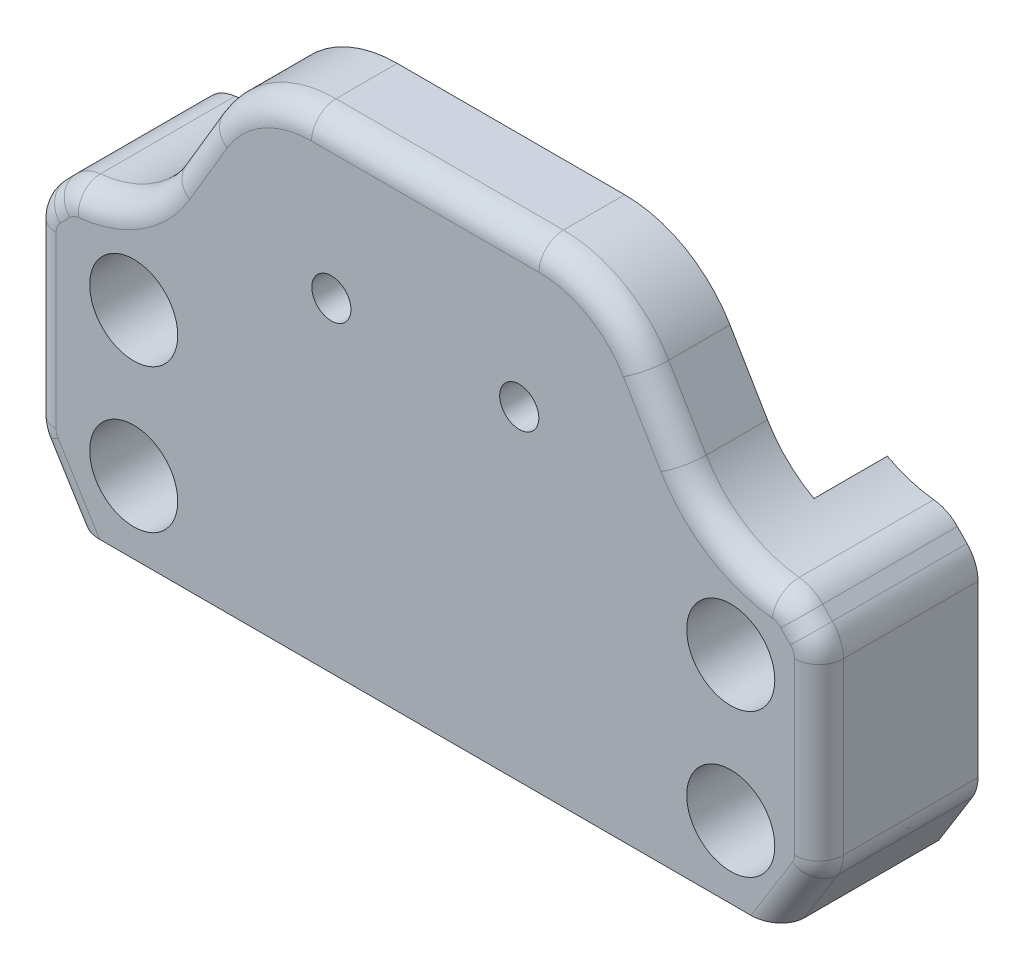
from build123d import *

# Parameters (mm, degrees)
BOSS_EXTRUDE1_DEPTH = 13
SHELL1_T            = -3
BOSS_EXTRUDE4_REACH = 64.152
SKETCH3_W           = 49.533157258
SKETCH3_H           = 6
CUT_EXTRUDE1_DEPTH  = 15
SKETCH4_R           = 1.6
CUT_EXTRUDE2_DEPTH  = 63.15219427
SKETCH7_R           = 2.1
SKETCH7_R_2         = 2.123676058
CUT_EXTRUDE3_DEPTH  = 63.15219427
FILLET2_R           = 10
SKETCH9_R           = 3.6
CUT_EXTRUDE4_DEPTH  = 10
FILLET3_R           = 2
FILLET4_R           = 2


with BuildPart() as part:
    # Sketch1 → Boss-Extrude1 (new body)
    with BuildSketch(Plane.XY):
        with BuildLine():
            Line((-28.97340569, 12.706331578), (28.973405725, 12.706331578))
            ThreePointArc((28.973405725, 12.706331578), (30.340636754, 14.906212876), (31.707400411, 17.106384579))
            add(Edge.make_bspline(
                [(31.707400411, 17.106384579), (31.860577483, 17.353017467), (31.977075411, 17.615910694), (32.136499753, 18.174255748), (32.176374769, 18.459007227), (32.176374769, 18.749342959)],
                knots=[0, 0, 0, 0, 0.5, 0.5, 1, 1, 1, 1], degree=3))
            Line((32.176374769, 18.749342959), (32.176374769, 32.652469049))
            add(Edge.make_bspline(
                [(32.176374769, 32.652469049), (32.176374769, 33.063943899), (32.098154583, 33.461022406), (31.865768669, 34.032167566), (31.771208107, 34.212098764), (31.549330643, 34.551940749), (31.421075594, 34.712743302), (31.277822081, 34.860353405)],
                knots=[0, 0, 0, 0, 0.5, 0.5, 0.75, 0.75, 1, 1, 1, 1], degree=3))
            Line((31.277822081, 34.860353405), (30.487300189, 35.674916452))
            ThreePointArc((30.487300189, 35.674916452), (29.607044875, 36.310979796), (28.562260308, 36.60737683))
            ThreePointArc((28.562260308, 36.60737683), (24.188286012, 38.132581102), (20.970896962, 41.465193727))
            Line((20.970896962, 41.465193727), (17.903524097, 46.651813915))
            ThreePointArc((17.903524097, 46.651813915), (14.250692031, 50.247702437), (9.296114179, 51.561382255))
            Line((9.296114179, 51.561382255), (-9.296114179, 51.561382255))
            ThreePointArc((-9.296114179, 51.561382255), (-14.250692031, 50.247702437), (-17.903524097, 46.651813915))
            Line((-17.903524097, 46.651813915), (-20.970896965, 41.465193723))
            ThreePointArc((-20.970896965, 41.465193723), (-24.188286003, 38.132581106), (-28.562260281, 36.607376829))
            ThreePointArc((-28.562260281, 36.607376829), (-29.607044844, 36.310979794), (-30.487300153, 35.674916452))
            Line((-30.487300153, 35.674916452), (-31.277822046, 34.860353405))
            add(Edge.make_bspline(
                [(-31.277822046, 34.860353405), (-31.56434582, 34.565115941), (-31.786145355, 34.226361182), (-32.019314667, 33.655528877), (-32.077486277, 33.460815095), (-32.156036537, 33.062812087), (-32.176374734, 32.858215252), (-32.176374734, 32.652469049)],
                knots=[0, 0, 0, 0, 0.5, 0.5, 0.75, 0.75, 1, 1, 1, 1], degree=3))
            Line((-32.176374734, 32.652469049), (-32.176374734, 18.749342959))
            add(Edge.make_bspline(
                [(-32.176374734, 18.749342959), (-32.176374734, 18.459007232), (-32.136497798, 18.174245088), (-31.977070924, 17.615899046), (-31.860577442, 17.353017458), (-31.707400375, 17.106384579)],
                knots=[0, 0, 0, 0, 0.5, 0.5, 1, 1, 1, 1], degree=3))
            ThreePointArc((-31.707400375, 17.106384579), (-30.340636718, 14.906212876), (-28.97340569, 12.706331578))
        make_face()
    extrude(amount=BOSS_EXTRUDE1_DEPTH)

    # Shell1
    shell1_openings = [part.faces().sort_by_distance(p)[0] for p in [
        (1.46e-07, 29.861622889, 0),
    ]]
    offset(amount=SHELL1_T, openings=shell1_openings, kind=Kind.INTERSECTION)

    # Boss-Extrude4: up to this face of the body (flat: up to its plane)
    boss_extrude4_end = Plane(part.part.faces().sort_by_distance((3.6e-08, 30.015982435, 10))[0])
    # Sketch6 → Boss-Extrude4 (add, up to the picked face)
    with BuildSketch(Plane(origin=(0, 0, 0), x_dir=(-1, 0, 0), z_dir=(0, 0, -1)), mode=Mode.PRIVATE) as boss_extrude4_sk1:
        with BuildLine():
            Line((-18.532419847, 45.588414212), (-18.532419847, 12.706331578))
            Line((-18.532419847, 12.706331578), (-28.973405725, 12.706331578))
            ThreePointArc((-28.973405725, 12.706331578), (-30.340636754, 14.906212876), (-31.707400411, 17.106384579))
            add(Edge.make_bspline(
                [(-32.176374769, 18.749342959), (-32.176374769, 18.459007227), (-32.136499753, 18.174255748), (-31.977075411, 17.615910694), (-31.860577483, 17.353017467), (-31.707400411, 17.106384579)],
                knots=[0, 0, 0, 0, 0.5, 0.5, 1, 1, 1, 1], degree=3))
            Line((-32.176374769, 18.749342959), (-32.176374769, 32.652469049))
            add(Edge.make_bspline(
                [(-31.277822081, 34.860353405), (-31.421075594, 34.712743302), (-31.549330643, 34.551940749), (-31.771208107, 34.212098764), (-31.865768669, 34.032167566), (-32.098154583, 33.461022406), (-32.176374769, 33.063943899), (-32.176374769, 32.652469049)],
                knots=[0, 0, 0, 0, 0.25, 0.25, 0.5, 0.5, 1, 1, 1, 1], degree=3))
            Line((-31.277822081, 34.860353405), (-30.487300189, 35.674916452))
            ThreePointArc((-30.487300189, 35.674916452), (-29.607044875, 36.310979796), (-28.562260308, 36.60737683))
            ThreePointArc((-28.562260308, 36.60737683), (-24.188286012, 38.132581102), (-20.970896962, 41.465193727))
            Line((-20.970896962, 41.465193727), (-18.532419847, 45.588414212))
        make_face()
    boss_extrude4_tool1 = split(extrude(boss_extrude4_sk1.sketch, amount=-BOSS_EXTRUDE4_REACH, mode=Mode.PRIVATE), bisect_by=boss_extrude4_end, keep=Keep.BOTH, mode=Mode.PRIVATE)
    # Sketch6 → Boss-Extrude4 (add, up to the picked face)
    with BuildSketch(Plane(origin=(0, 0, 0), x_dir=(-1, 0, 0), z_dir=(0, 0, -1)), mode=Mode.PRIVATE) as boss_extrude4_sk2:
        with BuildLine():
            Line((28.97340569, 12.706331578), (18.53241985, 12.706331578))
            Line((18.53241985, 12.706331578), (18.53241985, 45.588414209))
            Line((18.53241985, 45.588414209), (20.970896965, 41.465193723))
            ThreePointArc((20.970896965, 41.465193723), (24.188286003, 38.132581106), (28.562260281, 36.607376829))
            ThreePointArc((28.562260281, 36.607376829), (29.607044844, 36.310979794), (30.487300153, 35.674916452))
            Line((30.487300153, 35.674916452), (31.277822046, 34.860353405))
            add(Edge.make_bspline(
                [(31.277822046, 34.860353405), (31.421075558, 34.712743302), (31.549330608, 34.551940749), (31.771208072, 34.212098764), (31.865768634, 34.032167566), (32.098154547, 33.461022406), (32.176374734, 33.063943899), (32.176374734, 32.652469049)],
                knots=[0, 0, 0, 0, 0.25, 0.25, 0.5, 0.5, 1, 1, 1, 1], degree=3))
            Line((32.176374734, 32.652469049), (32.176374734, 18.749342959))
            add(Edge.make_bspline(
                [(32.176374734, 18.749342959), (32.176374734, 18.459007227), (32.136499717, 18.174255748), (31.977075375, 17.615910694), (31.860577447, 17.353017467), (31.707400375, 17.106384579)],
                knots=[0, 0, 0, 0, 0.5, 0.5, 1, 1, 1, 1], degree=3))
            ThreePointArc((31.707400375, 17.106384579), (30.340636718, 14.906212876), (28.97340569, 12.706331578))
        make_face()
    boss_extrude4_tool2 = split(extrude(boss_extrude4_sk2.sketch, amount=-BOSS_EXTRUDE4_REACH, mode=Mode.PRIVATE), bisect_by=boss_extrude4_end, keep=Keep.BOTH, mode=Mode.PRIVATE)
    add(boss_extrude4_tool1.solids().sort_by(Axis((24.781768, 26.007628, 0), (0, 0, 1)))[0])
    add(boss_extrude4_tool2.solids().sort_by(Axis((-24.781773, 26.007626, 0), (0, 0, 1)))[0])

    # Sketch3 → Cut-Extrude1 (cut)
    with BuildSketch(Plane(origin=(0, 51.561382255, 0), x_dir=(1, 0, 0), z_dir=(0, 1, 0))):
        with Locations((6e-09, -3)):
            Rectangle(SKETCH3_W, SKETCH3_H)
    extrude(amount=-CUT_EXTRUDE1_DEPTH, mode=Mode.SUBTRACT)

    # Sketch4 → Cut-Extrude2 (cut, through all)
    with BuildSketch(Plane.XY.offset(13)):
        with Locations((7.678839678, 39.239175199)):
            Circle(SKETCH4_R)
        with Locations((-7.678839678, 39.239175199)):
            Circle(SKETCH4_R)
    extrude(amount=-CUT_EXTRUDE2_DEPTH, mode=Mode.SUBTRACT)

    # Sketch7 → Cut-Extrude3 (cut, through all)
    with BuildSketch(Plane(origin=(0, 0, 0), x_dir=(-1, 0, 0), z_dir=(0, 0, -1))):
        with Locations((23.834250869, 30.330838597)):
            Circle(SKETCH7_R)
        with Locations((23.834250869, 18.586331578)):
            Circle(SKETCH7_R_2)
        with Locations((-24.965749131, 18.586331578)):
            Circle(SKETCH7_R)
        with Locations((-24.965749131, 30.330838597)):
            Circle(SKETCH7_R)
    extrude(amount=-CUT_EXTRUDE3_DEPTH, mode=Mode.SUBTRACT)

    # Fillet2
    # the kernel refuses this fillet: 10 mm, written as the material it takes off along each edge
    with BuildSketch(Plane(origin=(18.532419847, 36.561382255, -23.159560656), x_dir=(0, -1, 0), z_dir=(0, 0, 1))) as fillet2_piece_1:
        with BuildLine():
            CenterArc((9.263824262, 10), FILLET2_R, 202.122255088, 67.877744912)
            Line((0, 6.234158788), (0, 0))
            Line((0, 0), (9.263824262, 0))
        make_face()
    extrude(amount=29.159560656, mode=Mode.SUBTRACT)
    with BuildSketch(Plane(origin=(-18.53241985, 36.561382255, 6), x_dir=(-1, 0, 0), z_dir=(0, 0, -1))) as fillet2_piece_2:
        with BuildLine():
            CenterArc((10, -9.263824257), FILLET2_R, 112.122255177, 67.877744823)
            Line((0, -9.263824257), (0, 0))
            Line((0, 0), (6.234158773, 0))
        make_face()
    extrude(amount=29.159560641, mode=Mode.SUBTRACT)

    # Sketch9 → Cut-Extrude4 (cut)
    with BuildSketch(Plane.XY.offset(13)):
        with Locations((-23.834250869, 18.586331578)):
            Circle(SKETCH9_R)
        with Locations((-23.834250869, 30.330838597)):
            Circle(SKETCH9_R)
        with Locations((24.965749131, 18.586331578)):
            Circle(SKETCH9_R)
        with Locations((24.965749131, 30.330838597)):
            Circle(SKETCH9_R)
    extrude(amount=-CUT_EXTRUDE4_DEPTH, mode=Mode.SUBTRACT)

    # Fillet3
    fillet3_edges = [part.edges().sort_by_distance(p)[0] for p in [
        (30.340636754, 14.906212876, 13),
        (32.056784474, 17.895072339, 13),
        (32.176374769, 25.700906004, 13),
        (31.942376042, 33.843884106, 13),
        (30.882561135, 35.267634928, 13),
        (29.607044875, 36.310979796, 13),
        (24.188286012, 38.132581102, 13),
        (19.43721053, 44.058503821, 13),
        (14.250692031, 50.247702437, 13),
        (0, 51.561382255, 13),
        (-14.250692031, 50.247702437, 13),
        (-19.437210531, 44.058503819, 13),
        (-24.188286003, 38.132581106, 13),
        (-29.607044844, 36.310979794, 13),
        (-30.8825611, 35.267634928, 13),
        (-31.942337939, 33.843977464, 13),
        (-30.340636718, 14.906212876, 13),
        (-32.056784423, 17.895072281, 13),
        (-32.176374734, 25.700906004, 13),
    ]]
    fillet(fillet3_edges, radius=FILLET3_R)

    # Fillet4
    fillet4_edges = [part.edges().sort_by_distance(p)[0] for p in [
        (18.532419847, 15.706331578, 5),
        (-18.53241985, 15.706331578, 5),
    ]]
    fillet(fillet4_edges, radius=FILLET4_R)


solid = part.part
